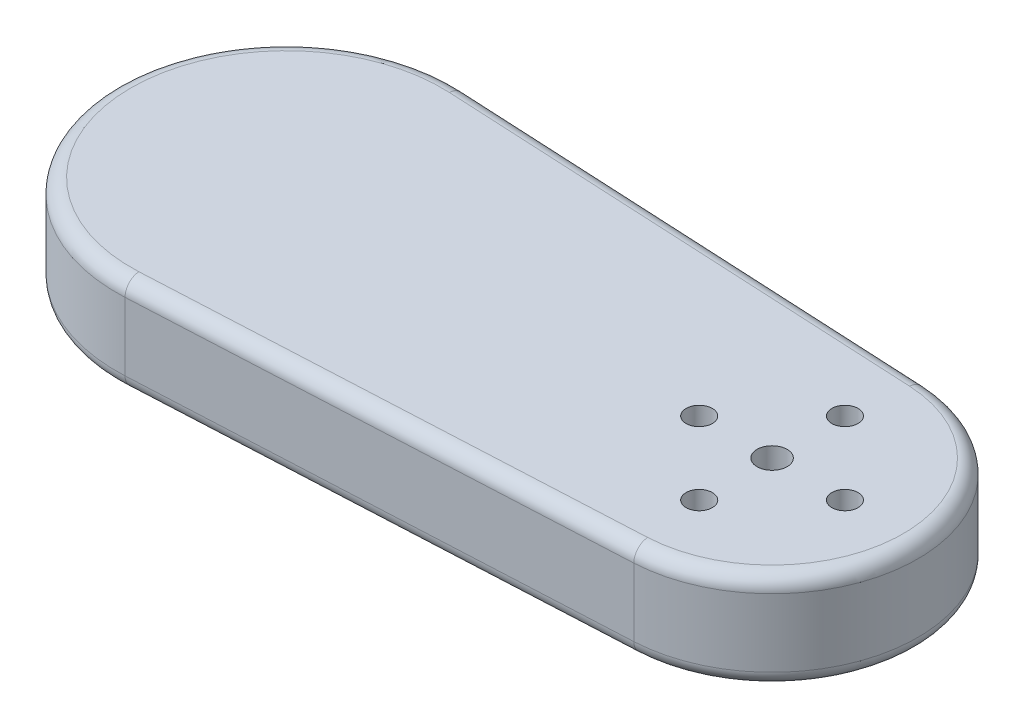
from build123d import *

# Parameters (mm, degrees)
SKETCH1_R           = 14.5
SKETCH1_R_2         = 1.35
SKETCH1_R_3         = 1.55
BOSS_EXTRUDE1_DEPTH = 10
BOSS_EXTRUDE2_START = -2.1
SKETCH2_R           = 14.5
BOSS_EXTRUDE2_DEPTH = 2.1
FILLET1_R           = 1.5


with BuildPart() as part:
    # Sketch1 → Boss-Extrude1 (new body)
    with BuildSketch(Plane(origin=(0, 0, 0), x_dir=(1, 0, 0), z_dir=(0, 1, 0))):
        with BuildLine():
            ThreePointArc((0.875, 17.478111311), (-17.5, 0), (0.875, -17.478111311))
            Line((0.875, -17.478111311), (50.75, -14.981238267))
            ThreePointArc((50.75, -14.981238267), (65, 0), (50.75, 14.981238267))
            Line((50.75, 14.981238267), (0.875, 17.478111311))
        make_face()
        with Locations(Location((0, 0, 0), (0, 0, 270))):
            Circle(SKETCH1_R, mode=Mode.SUBTRACT)
        with Locations(Location((50, -7.5, 0), (0, 0, 270))):
            Circle(SKETCH1_R_2, mode=Mode.SUBTRACT)
        with BuildLine():
            ThreePointArc((43.85, 0), (42.5, -1.35), (41.15, 0))
            ThreePointArc((41.15, 0), (42.5, 1.35), (43.85, 0))
        make_face(mode=Mode.SUBTRACT)
        with Locations(Location((50, 0, 0), (0, 0, 270))):
            Circle(SKETCH1_R_3, mode=Mode.SUBTRACT)
        with Locations(Location((57.5, 0, 0), (0, 0, 270))):
            Circle(SKETCH1_R_2, mode=Mode.SUBTRACT)
        with Locations(Location((50, 7.5, 0), (0, 0, 270))):
            Circle(SKETCH1_R_2, mode=Mode.SUBTRACT)
    extrude(amount=BOSS_EXTRUDE1_DEPTH)

    # Sketch2 → Boss-Extrude2 (add)
    with BuildSketch(Plane(origin=(0, 10, 0), x_dir=(1, 0, 0), z_dir=(0, 1, 0)).offset(BOSS_EXTRUDE2_START)):
        with Locations(Location((0, 0, 0), (0, 0, 270))):
            Circle(SKETCH2_R)
    extrude(amount=BOSS_EXTRUDE2_DEPTH)

    # Fillet1
    fillet1_edges = [part.edges().sort_by_distance(p)[0] for p in [
        (25.8125, 10, -16.229674789),
        (0, 0, -14.5),
        (65, 0, 0),
        (-17.5, 10, 0),
        (25.8125, 0, 16.229674789),
        (-17.5, 0, 0),
        (25.8125, 0, -16.229674789),
        (25.8125, 10, 16.229674789),
        (65, 10, 0),
    ]]
    fillet(fillet1_edges, radius=FILLET1_R - 0.0001)  # a hair under: the kernel refuses the full size


solid = part.part
